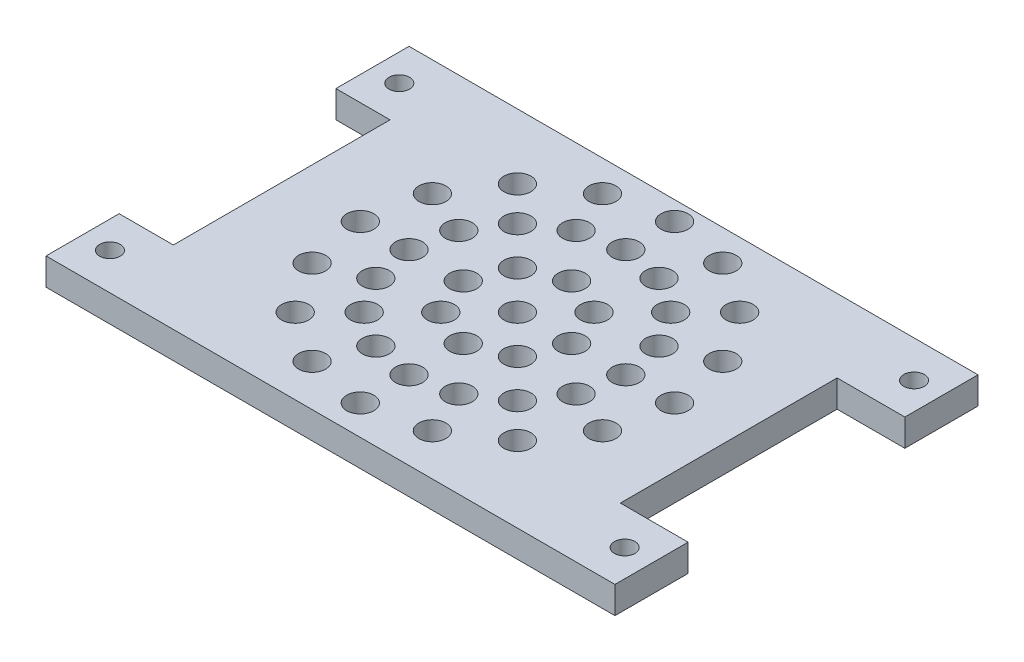
from build123d import *

# Parameters (mm, degrees)
SKETCH1_W           = 133.35
SKETCH1_H           = 85.09
BOSS_EXTRUDE1_DEPTH = 6.35
SKETCH4_W           = 15.875
SKETCH4_H           = 50.8
SKETCH4_W_2         = 12.7
CUT_EXTRUDE8_DEPTH  = 101.417876049
SKETCH2_R           = 2.413
CUT_EXTRUDE1_DEPTH  = 101.417876049
SKETCH3_R           = 3.175
CUT_EXTRUDE7_DEPTH  = 101.417876049


with BuildPart() as part:
    # Sketch1 → Boss-Extrude1 (new body)
    with BuildSketch(Plane(origin=(0, 0, 0), x_dir=(1, 0, 0), z_dir=(0, 1, 0))):
        with Locations((21.486627907, 5.109534884)):
            Rectangle(SKETCH1_W, SKETCH1_H)
    extrude(amount=BOSS_EXTRUDE1_DEPTH)

    # Sketch4 → Cut-Extrude8 (cut, through all)
    with BuildSketch(Plane(origin=(0, 6.35, 0), x_dir=(1, 0, 0), z_dir=(0, 1, 0))):
        with Locations((80.224127907, 5.109534884)):
            Rectangle(SKETCH4_W, SKETCH4_H)
        with Locations((-38.838372093, 5.109534884)):
            Rectangle(SKETCH4_W_2, SKETCH4_H)
    extrude(amount=-CUT_EXTRUDE8_DEPTH, mode=Mode.SUBTRACT)

    # Sketch2 → Cut-Extrude1 (cut, through all)
    with BuildSketch(Plane(origin=(0, 6.35, 0), x_dir=(1, 0, 0), z_dir=(0, 1, 0))):
        with Locations((81.811627907, -28.799465116)):
            Circle(SKETCH2_R)
        with Locations((81.811627907, 39.018534884)):
            Circle(SKETCH2_R)
        with Locations((-38.838372093, 39.018534884)):
            Circle(SKETCH2_R)
        with Locations((-38.838372093, -28.799465116)):
            Circle(SKETCH2_R)
    extrude(amount=-CUT_EXTRUDE1_DEPTH, mode=Mode.SUBTRACT)

    # Sketch3 → Cut-Extrude7 (cut, through all)
    with BuildSketch(Plane(origin=(0, 6.35, 0), x_dir=(1, 0, 0), z_dir=(0, 1, 0))):
        with Locations((21.486627907, 6.379534884)):
            Circle(SKETCH3_R)
        with Locations((34.186627907, 6.379534884)):
            Circle(SKETCH3_R)
        with Locations((46.886627907, 6.379534884)):
            Circle(SKETCH3_R)
        with Locations((30.466884028, -2.600721237)):
            Circle(SKETCH3_R)
        with Locations((21.486627907, -6.320465116)):
            Circle(SKETCH3_R)
        with Locations((12.506371786, -2.600721237)):
            Circle(SKETCH3_R)
        with Locations((8.786627907, 6.379534884)):
            Circle(SKETCH3_R)
        with Locations((12.506371786, 15.359791005)):
            Circle(SKETCH3_R)
        with Locations((21.486627907, 19.079534884)):
            Circle(SKETCH3_R)
        with Locations((30.466884028, 15.359791005)):
            Circle(SKETCH3_R)
        with Locations((44.953168033, -3.340624298)):
            Circle(SKETCH3_R)
        with Locations((39.447140149, -11.580977358)):
            Circle(SKETCH3_R)
        with Locations((31.206787089, -17.087005242)):
            Circle(SKETCH3_R)
        with Locations((21.486627907, -19.020465116)):
            Circle(SKETCH3_R)
        with Locations((11.766468725, -17.087005242)):
            Circle(SKETCH3_R)
        with Locations((3.526115665, -11.580977358)):
            Circle(SKETCH3_R)
        with Locations((-1.979912219, -3.340624298)):
            Circle(SKETCH3_R)
        with Locations((-3.913372093, 6.379534884)):
            Circle(SKETCH3_R)
        with Locations((-1.979912219, 16.099694066)):
            Circle(SKETCH3_R)
        with Locations((3.526115665, 24.340047126)):
            Circle(SKETCH3_R)
        with Locations((11.766468725, 29.84607501)):
            Circle(SKETCH3_R)
        with Locations((21.486627907, 31.779534884)):
            Circle(SKETCH3_R)
        with Locations((31.206787089, 29.84607501)):
            Circle(SKETCH3_R)
        with Locations((39.447140149, 24.340047126)):
            Circle(SKETCH3_R)
        with Locations((44.953168033, 16.099694066)):
            Circle(SKETCH3_R)
        with Locations((58.316627907, 6.379534884)):
            Circle(SKETCH3_R)
        with Locations((55.513111089, -7.71469593)):
            Circle(SKETCH3_R)
        with Locations((47.529370658, -19.663207867)):
            Circle(SKETCH3_R)
        with Locations((35.580858721, -27.646948299)):
            Circle(SKETCH3_R)
        with Locations((21.486627907, -30.450465116)):
            Circle(SKETCH3_R)
        with Locations((7.392397093, -27.646948299)):
            Circle(SKETCH3_R)
        with Locations((-4.556114844, -19.663207867)):
            Circle(SKETCH3_R)
        with Locations((-12.539855275, -7.71469593)):
            Circle(SKETCH3_R)
        with Locations((-15.343372093, 6.379534884)):
            Circle(SKETCH3_R)
        with Locations((-12.539855275, 20.473765698)):
            Circle(SKETCH3_R)
        with Locations((-4.556114844, 32.422277635)):
            Circle(SKETCH3_R)
        with Locations((7.392397093, 40.406018066)):
            Circle(SKETCH3_R)
        with Locations((21.486627907, 43.209534884)):
            Circle(SKETCH3_R)
        with Locations((35.580858721, 40.406018066)):
            Circle(SKETCH3_R)
        with Locations((47.529370658, 32.422277635)):
            Circle(SKETCH3_R)
        with Locations((55.513111089, 20.473765698)):
            Circle(SKETCH3_R)
    extrude(amount=-CUT_EXTRUDE7_DEPTH, mode=Mode.SUBTRACT)


solid = part.part
